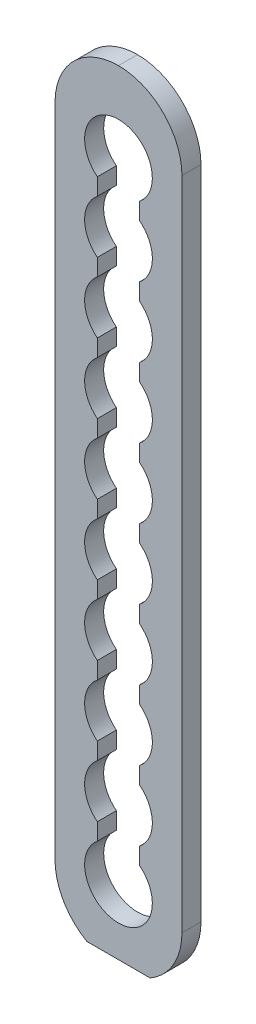
from build123d import *

# Parameters (mm, degrees)
CROQUIS1_W              = 30
CROQUIS1_H              = 185
SALIENTE_EXTRUIR1_DEPTH = 4.5
REDONDEO1_R             = 15
CROQUIS2_R              = 8
CORTAR_EXTRUIR1_DEPTH   = 10
CROQUIS3_W              = 36.075387002
CROQUIS3_H              = 11.559576231
CORTAR_EXTRUIR2_DEPTH   = 10


with BuildPart() as part:
    # Croquis1 → Saliente-Extruir1 (new body)
    with BuildSketch(Plane.XY):
        Rectangle(CROQUIS1_W, CROQUIS1_H)
        with BuildLine():
            Line((5, 72.5), (5, -72.5))
            ThreePointArc((5, -72.5), (0, -77.5), (-5, -72.5))
            Line((-5, -72.5), (-5, 72.5))
            ThreePointArc((-5, 72.5), (0, 77.5), (5, 72.5))
        make_face(mode=Mode.SUBTRACT)
    extrude(amount=SALIENTE_EXTRUIR1_DEPTH)

    # Redondeo1
    redondeo1_edges = [part.edges().sort_by_distance(p)[0] for p in [
        (15, -92.5, 2.25),
        (-15, -92.5, 2.25),
        (-15, 92.5, 2.25),
        (15, 92.5, 2.25),
    ]]
    fillet(redondeo1_edges, radius=REDONDEO1_R - 0.0001)  # a hair under: the kernel refuses the full size

    # Croquis2 → Cortar-Extruir1 (cut)
    with BuildSketch(Plane.XY.offset(4.5)):
        with Locations((0, 73.5)):
            Circle(CROQUIS2_R)
        with Locations((0, 57)):
            Circle(CROQUIS2_R)
        with Locations((0, 40.5)):
            Circle(CROQUIS2_R)
        with Locations((0, 24)):
            Circle(CROQUIS2_R)
        with Locations((0, 7.5)):
            Circle(CROQUIS2_R)
        with Locations((0, -9)):
            Circle(CROQUIS2_R)
        with Locations((0, -25.5)):
            Circle(CROQUIS2_R)
        with Locations((0, -42)):
            Circle(CROQUIS2_R)
        with Locations((0, -58.5)):
            Circle(CROQUIS2_R)
        with Locations((0, -75)):
            Circle(CROQUIS2_R)
    extrude(amount=-CORTAR_EXTRUIR1_DEPTH, mode=Mode.SUBTRACT)

    # Croquis3 → Cortar-Extruir2 (cut)
    with BuildSketch(Plane.XY.offset(4.5)):
        with Locations((0.166198184, -96.279788115)):
            Rectangle(CROQUIS3_W, CROQUIS3_H)
    extrude(amount=-CORTAR_EXTRUIR2_DEPTH, mode=Mode.SUBTRACT)


solid = part.part
